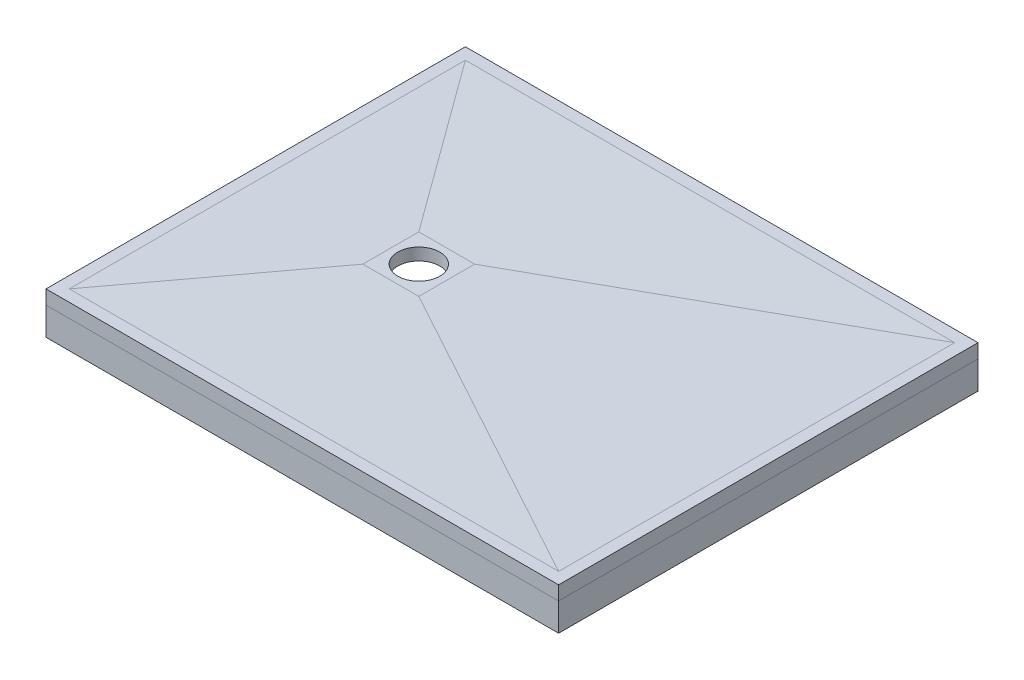
from build123d import *

# Parameters (mm, degrees)
SKETCH_1_W          = 1100
SKETCH_1_H          = 900
EXTRUDE_1_DEPTH     = 30
SKETCH_5_R          = 45
CUT_EXTRUDE_4_DEPTH = 1422.504836432
SKETCH_7_W          = 1100
SKETCH_7_H          = 900
SKETCH_7_W_2        = 1040
SKETCH_7_H_2        = 840
EXTRUDE_2_DEPTH     = 60


with BuildPart() as part:
    # Эскиз1 → Бобышка-Вытянуть1 (new body)
    with BuildSketch(Plane(origin=(0, 0, 0), x_dir=(1, 0, 0), z_dir=(0, 1, 0))):
        with Locations((550, 450)):
            Rectangle(SKETCH_1_W, SKETCH_1_H)
    extrude(amount=EXTRUDE_1_DEPTH)

    # Вырез-По сечениям2: read off the stored shape, not the designer's step
    # Вырез-По сечениям2: loft between two sections, ruled curve by curve
    loft_2_from = [
        Edge.make_line((1075, 30, -875), (25, 30, -875)),
        Edge.make_line((25, 30, -875), (25, 30, -25)),
        Edge.make_line((1075, 30, -25), (1075, 30, -875)),
        Edge.make_line((25, 30, -25), (1075, 30, -25)),
    ]
    loft_2_to = [
        Edge.make_line((410, 26, -510), (290, 26, -510)),
        Edge.make_line((290, 26, -510), (290, 26, -390)),
        Edge.make_line((410, 26, -390), (410, 26, -510)),
        Edge.make_line((290, 26, -390), (410, 26, -390)),
    ]
    loft_2 = Solid(Shell([*[Face.make_surface_from_curves(loft_2_from[k], loft_2_to[k]) for k in range(4)], Face(Wire(loft_2_from)), Face(Wire(loft_2_to))]))
    add(loft_2, mode=Mode.SUBTRACT)

    # Эскиз5 → Вырез-Вытянуть4 (cut, through all)
    with BuildSketch(Plane(origin=(0, 26, 0), x_dir=(-1, 0, 0), z_dir=(0, 1, 0))):
        with Locations(Location((-350, -450, 0), (0, 0, 90))):
            Circle(SKETCH_5_R)
    extrude(amount=-CUT_EXTRUDE_4_DEPTH, mode=Mode.SUBTRACT)


with BuildPart() as body_2:
    # Эскиз7 → Бобышка-Вытянуть2 (new body)
    with BuildSketch(Plane(origin=(0, 0, 0), x_dir=(-1, 0, 0), z_dir=(0, -1, 0))):
        with Locations((-550, 450)):
            Rectangle(SKETCH_7_W, SKETCH_7_H)
        with Locations((-550, 450)):
            Rectangle(SKETCH_7_W_2, SKETCH_7_H_2, mode=Mode.SUBTRACT)
    extrude(amount=EXTRUDE_2_DEPTH)


solid = Compound([part.part, body_2.part])
